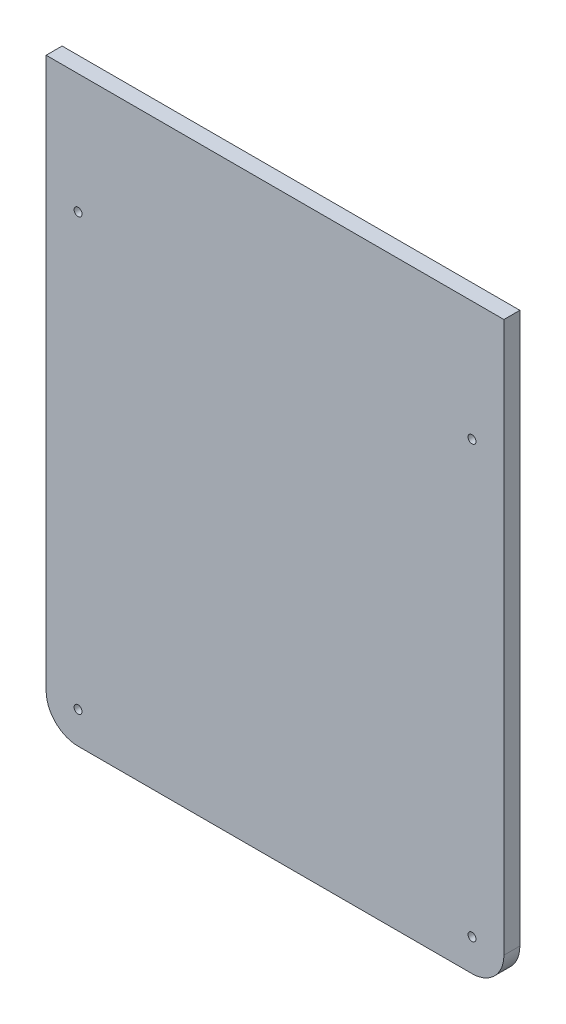
from build123d import *

# Parameters (mm, degrees)
BOSS_EXTRUDE1_DEPTH = 6.35
HOLE1_D             = 3.175
HOLE1_DEPTH         = 31.75
HOLE1_CSINK_D       = 10.16
HOLE1_CSINK_ANGLE   = 82
HOLE1_TIP           = 0.953866233


with BuildPart() as part:
    # Sketch1 → Boss-Extrude1 (new body)
    with BuildSketch(Plane.XY):
        with BuildLine():
            Line((-19.05, 903.02716301), (163.099999994, 903.02716301))
            Line((163.099999994, 903.02716301), (163.099999994, 683.95216301))
            ThreePointArc((163.099999994, 683.95216301), (159.380256115, 674.971906889), (150.399999994, 671.25216301))
            Line((150.399999994, 671.25216301), (-6.35, 671.25216301))
            ThreePointArc((-6.35, 671.25216301), (-15.330256121, 674.971906889), (-19.05, 683.95216301))
            Line((-19.05, 683.95216301), (-19.05, 903.02716301))
        make_face()
    extrude(amount=BOSS_EXTRUDE1_DEPTH)

    # Hole1
    with Locations(Plane(origin=(72.024999997, -454.785607328, 19.05), x_dir=(1, 0, 0), z_dir=(0, 0, 1))):
        with Locations((-78.374999997, 1310.187770337), (-78.374999997, 1138.737770337), (78.374999997, 1138.737770337), (78.374999997, 1310.187770337)):
            CounterSinkHole(HOLE1_D / 2, HOLE1_CSINK_D / 2, depth=HOLE1_DEPTH, counter_sink_angle=HOLE1_CSINK_ANGLE)
            with Locations((0, 0, -(HOLE1_DEPTH + HOLE1_TIP / 2))):  # 118° drill point
                Cone(0, HOLE1_D / 2, HOLE1_TIP, mode=Mode.SUBTRACT)


solid = part.part
